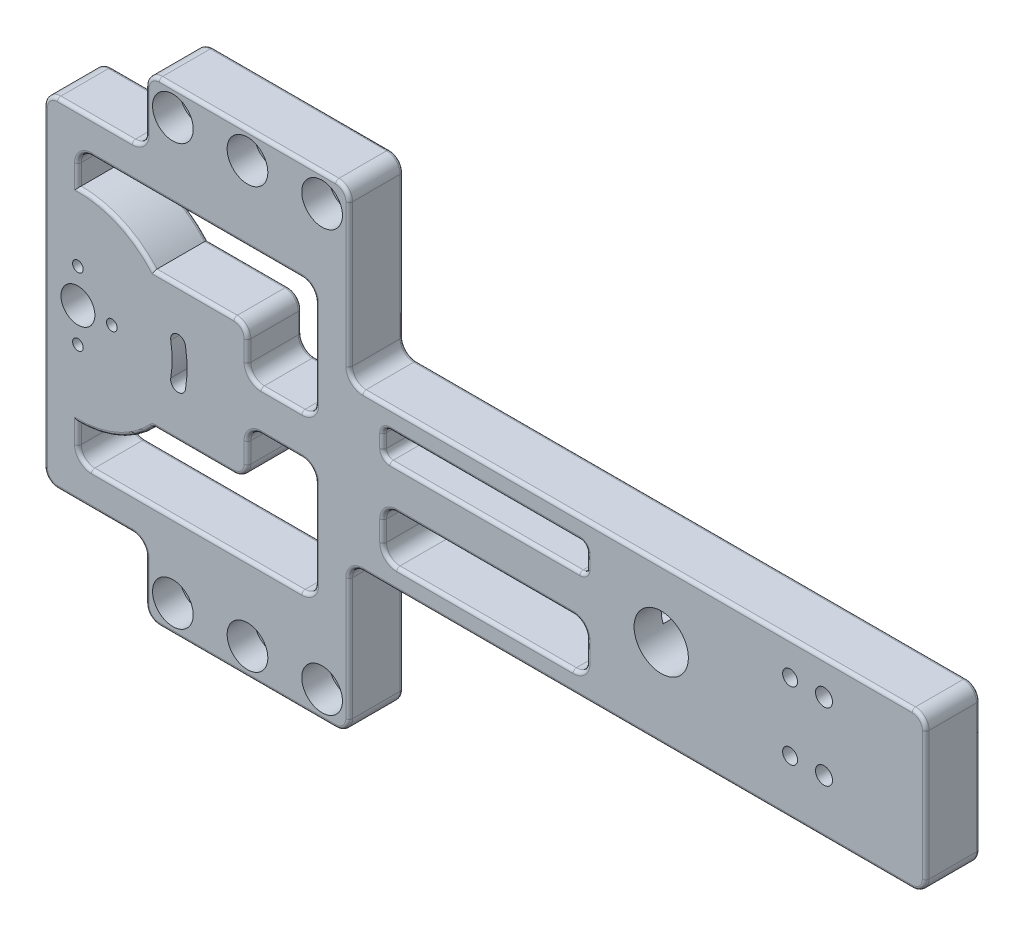
from build123d import *

# Parameters (mm, degrees)
BOSS_EXTRUDE1_DEPTH       = 8
SKETCH3_R                 = 3
CUT_EXTRUDE1_DEPTH        = 4
SKETCH3_3_R               = 1.6
CUT_EXTRUDE2_DEPTH        = 8
SKETCH4_R                 = 2.5
SKETCH4_R_2               = 0.7835
CUT_EXTRUDE3_DEPTH        = 4
SKETCH4_2_R               = 2.5
SKETCH4_2_R_2             = 0.7835
CUT_EXTRUDE4_DEPTH        = 8
FILLET1_R                 = 2
SKETCH6_R                 = 2
CUT_EXTRUDE6_DEPTH        = 4
SKETCH6_3_R               = 1.1
CUT_EXTRUDE7_DEPTH        = 8
SKETCH7_R                 = 4
CUT_EXTRUDE8_DEPTH        = 8
CUT_EXTRUDE9_DEPTH        = 4
SKETCH9_W                 = 30
SKETCH9_H                 = 4
SKETCH9_H_2               = 7
CUT_EXTRUDE10_DEPTH       = 8
FILLET2_R                 = 2
FILLET3_R                 = 1
FILLET4_R                 = 0.5
F_3_0MM_DOWEL_HOLE1_D     = 3
F_3_0MM_DOWEL_HOLE1_DEPTH = 6.098709071
F_3_0MM_DOWEL_HOLE1_TIP   = 0.901290929
THREAD1_PITCH             = 0.5
THREAD1_FROM              = 1
THREAD2_PITCH             = 0.5
THREAD2_FROM              = 1
F_2_5MM_DOWEL_HOLE1_D     = 2.5
F_2_5MM_DOWEL_HOLE1_DEPTH = 4
F_2_5MM_DOWEL_HOLE1_TIP   = 0.751075774
F_2_5MM_DOWEL_HOLE2_D     = 2.5
F_2_5MM_DOWEL_HOLE2_DEPTH = 4
F_2_5MM_DOWEL_HOLE2_TIP   = 0.751075774
CUT_EXTRUDE11_DEPTH       = 4
CUT_EXTRUDE12_DEPTH       = 8
F_2_5MM_DOWEL_HOLE3_D     = 2.5
F_2_5MM_DOWEL_HOLE3_DEPTH = 4
F_2_5MM_DOWEL_HOLE3_TIP   = 0.751075774


with BuildPart() as part:
    # Sketch1 → Boss-Extrude1 (new body)
    with BuildSketch(Plane.XY):
        Polygon((-65, 25), (-65, -25), (-50, -25), (-50, -35), (-20, -35), (-20, -13), (65, -13), (65, 10), (-20, 10), (-20, 35), (-50, 35), (-50, 25), align=None)
    extrude(amount=BOSS_EXTRUDE1_DEPTH)

    # Sketch3 → Cut-Extrude1 (cut)
    with BuildSketch(Plane.XY.offset(8)):
        with Locations((-46, -31)):
            Circle(SKETCH3_R)
        with Locations((-35, -31)):
            Circle(SKETCH3_R)
        with Locations((-24, -31)):
            Circle(SKETCH3_R)
    cut_extrude1 = extrude(amount=-CUT_EXTRUDE1_DEPTH, mode=Mode.SUBTRACT)

    # Sketch3<3> → Cut-Extrude2 (cut)
    with BuildSketch(Plane.XY.offset(8)):
        with Locations((-46, -31)):
            Circle(SKETCH3_3_R)
        with Locations((-35, -31)):
            Circle(SKETCH3_3_R)
        with Locations((-24, -31)):
            Circle(SKETCH3_3_R)
    cut_extrude2 = extrude(amount=-CUT_EXTRUDE2_DEPTH, mode=Mode.SUBTRACT)

    # Mirror1: Cut-Extrude1, Cut-Extrude2 across plane
    add(cut_extrude1.mirror(Plane.ZX), mode=Mode.SUBTRACT)
    add(cut_extrude2.mirror(Plane.ZX), mode=Mode.SUBTRACT)

    # Sketch4 → Cut-Extrude3 (cut)
    with BuildSketch(Plane(origin=(0, 0, 0), x_dir=(-1, 0, 0), z_dir=(0, 0, -1))):
        with BuildLine():
            Line((65, 6.244997998), (65, -6.244997998))
            ThreePointArc((65, -6.244997998), (52, 0), (65, 6.244997998))
        make_face()
        with Locations((60, 0)):
            Circle(SKETCH4_R, mode=Mode.SUBTRACT)
        with Locations((60, 5)):
            Circle(SKETCH4_R_2, mode=Mode.SUBTRACT)
        with Locations((55, 0)):
            Circle(SKETCH4_R_2, mode=Mode.SUBTRACT)
        with Locations((60, -5)):
            Circle(SKETCH4_R_2, mode=Mode.SUBTRACT)
    extrude(amount=-CUT_EXTRUDE3_DEPTH, mode=Mode.SUBTRACT)

    # Sketch4<2> → Cut-Extrude4 (cut)
    with BuildSketch(Plane(origin=(0, 0, 0), x_dir=(-1, 0, 0), z_dir=(0, 0, -1))):
        with Locations((60, 0)):
            Circle(SKETCH4_2_R)
        with Locations((60, 5)):
            Circle(SKETCH4_2_R_2)
        with Locations((55, 0)):
            Circle(SKETCH4_2_R_2)
        with Locations((60, -5)):
            Circle(SKETCH4_2_R_2)
    extrude(amount=-CUT_EXTRUDE4_DEPTH, mode=Mode.SUBTRACT)

    # Fillet1
    fillet1_edges = [part.edges().sort_by_distance(p)[0] for p in [
        (-50, 35, 4),
        (-20, 35, 4),
        (-20, 10, 4),
        (65, 10, 4),
        (65, -13, 4),
        (-20, -13, 4),
        (-20, -35, 4),
        (-50, -35, 4),
        (-50, -25, 4),
        (-65, -25, 4),
        (-65, 25, 4),
        (-50, 25, 4),
    ]]
    fillet(fillet1_edges, radius=FILLET1_R)

    # Sketch6 → Cut-Extrude6 (cut)
    with BuildSketch(Plane(origin=(0, 0, 0), x_dir=(-1, 0, 0), z_dir=(0, 0, -1))):
        with Locations((-45, 5)):
            Circle(SKETCH6_R)
        with Locations((-45, -5)):
            Circle(SKETCH6_R)
    extrude(amount=-CUT_EXTRUDE6_DEPTH, mode=Mode.SUBTRACT)

    # Sketch6<3> → Cut-Extrude7 (cut)
    with BuildSketch(Plane(origin=(0, 0, 0), x_dir=(-1, 0, 0), z_dir=(0, 0, -1))):
        with Locations((-45, 5)):
            Circle(SKETCH6_3_R)
        with Locations((-45, -5)):
            Circle(SKETCH6_3_R)
    extrude(amount=-CUT_EXTRUDE7_DEPTH, mode=Mode.SUBTRACT)

    # Sketch7 → Cut-Extrude8 (cut)
    with BuildSketch(Plane(origin=(0, 0, 0), x_dir=(-1, 0, 0), z_dir=(0, 0, -1))):
        with Locations((-26, 0)):
            Circle(SKETCH7_R)
    extrude(amount=-CUT_EXTRUDE8_DEPTH, mode=Mode.SUBTRACT)

    # Sketch7<3> → Cut-Extrude9 (cut)
    with BuildSketch(Plane(origin=(0, 0, 0), x_dir=(-1, 0, 0), z_dir=(0, 0, -1))):
        with BuildLine():
            Line((-31, 1.5), (-21, 1.5))
            ThreePointArc((-21, 1.5), (-19.5, 0), (-21, -1.5))
            Line((-21, -1.5), (-31, -1.5))
            ThreePointArc((-31, -1.5), (-32.5, 0), (-31, 1.5))
        make_face()
    extrude(amount=-CUT_EXTRUDE9_DEPTH, mode=Mode.SUBTRACT)

    # Sketch9 → Cut-Extrude10 (cut)
    with BuildSketch(Plane(origin=(0, 0, 0), x_dir=(-1, 0, 0), z_dir=(0, 0, -1))):
        with BuildLine():
            Line((35, 10), (35, 3))
            Line((35, 3), (25, 3))
            Line((25, 3), (25, 20))
            Line((25, 20), (60, 20))
            Line((60, 20), (60, 15))
            ThreePointArc((60, 15), (53.876275643, 13.693063938), (48.819660113, 10))
            Line((48.819660113, 10), (35, 10))
        make_face()
        with BuildLine():
            Line((35, -10), (48.819660113, -10))
            ThreePointArc((48.819660113, -10), (53.876275643, -13.693063938), (60, -15))
            Line((60, -15), (60, -20))
            Line((60, -20), (25, -20))
            Line((25, -20), (25, -3))
            Line((25, -3), (35, -3))
            Line((35, -3), (35, -10))
        make_face()
        with Locations((0, 5)):
            Rectangle(SKETCH9_W, SKETCH9_H)
        with Locations((0, -6.5)):
            Rectangle(SKETCH9_W, SKETCH9_H_2)
    extrude(amount=-CUT_EXTRUDE10_DEPTH, mode=Mode.SUBTRACT)

    # Fillet2
    fillet2_edges = [part.edges().sort_by_distance(p)[0] for p in [
        (-35, -3, 4),
        (-35, -10, 4),
        (-60, -20, 4),
        (-25, -20, 4),
        (-25, -3, 4),
        (15, -10, 4),
        (15, -3, 4),
        (-15, -3, 4),
        (-15, -10, 4),
        (-35, 10, 4),
        (-35, 3, 4),
        (-25, 3, 4),
        (-25, 20, 4),
        (-60, 20, 4),
    ]]
    fillet(fillet2_edges, radius=FILLET2_R)

    # Fillet3
    fillet3_edges = [part.edges().sort_by_distance(p)[0] for p in [
        (15, 3, 4),
        (15, 7, 4),
        (-15, 7, 4),
        (-15, 3, 4),
    ]]
    fillet(fillet3_edges, radius=FILLET3_R)

    # Fillet4
    fillet4_edges = [part.edges().sort_by_distance(p)[0] for p in [
        (-57.5, -25, 0),
        (-57.5, -25, 8),
        (-65, 14.622498999, 0),
        (-57.5, 25, 0),
        (-50, 30, 0),
        (-35, 35, 0),
        (-20, 22.5, 0),
        (22.5, 10, 0),
        (65, -1.5, 0),
        (22.5, -13, 0),
        (-20, -24, 0),
        (-35, -35, 0),
        (-50, -30, 0),
        (-64.414213562, 24.414213562, 0),
        (-49.414213562, 34.414213562, 0),
        (-20.585786438, 34.414213562, 0),
        (64.414213562, 9.414213562, 0),
        (64.414213562, -12.414213562, 0),
        (-20.585786438, -34.414213562, 0),
        (-49.414213562, -34.414213562, 0),
        (-64.414213562, -24.414213562, 0),
        (-65, 0, 8),
        (-50, 30, 8),
        (-57.5, 25, 8),
        (-50, -30, 8),
        (-35, -35, 8),
        (-20, -24, 8),
        (22.5, -13, 8),
        (65, -1.5, 8),
        (22.5, 10, 8),
        (-20, 22.5, 8),
        (-35, 35, 8),
        (-64.414213562, 24.414213562, 8),
        (-49.414213562, 34.414213562, 8),
        (-20.585786438, 34.414213562, 8),
        (64.414213562, 9.414213562, 8),
        (64.414213562, -12.414213562, 8),
        (-20.585786438, -34.414213562, 8),
        (-49.414213562, -34.414213562, 8),
        (-64.414213562, -24.414213562, 8),
        (-50.585786438, -25.585786438, 0),
        (-50.585786438, -25.585786438, 8),
        (-19.414213562, -13.585786438, 0),
        (-19.414213562, -13.585786438, 8),
        (-19.414213562, 10.585786438, 0),
        (-19.414213562, 10.585786438, 8),
        (-50.585786438, 25.585786438, 0),
        (-50.585786438, 25.585786438, 8),
        (-42.909830056, -10, 8),
        (-53.876275643, -13.693063938, 8),
        (-48.819660113, -10, 4),
        (-53.876275643, -13.693063938, 0),
        (-42.909830056, -10, 0),
        (-60, 16.5, 8),
        (-53.876275643, 13.693063938, 8),
        (-53.876275643, 13.693063938, 0),
        (-60, 16.5, 0),
        (-60, -16.5, 0),
        (-60, -16.5, 8),
        (-42.5, -20, 0),
        (-42.5, -20, 8),
        (-15, -6.5, 0),
        (-15, -6.5, 8),
        (0, -10, 0),
        (0, -10, 8),
        (15, -6.5, 0),
        (15, -6.5, 8),
        (0, -3, 0),
        (0, -3, 8),
        (-25, -11.5, 0),
        (-25, -11.5, 8),
        (-35, -6.5, 0),
        (-35, -6.5, 8),
        (-42.909830056, 10, 0),
        (-35, 6.5, 0),
        (-30, 3, 0),
        (-25, 11.5, 0),
        (-42.5, 20, 0),
        (-30, -3, 0),
        (-35.585786438, 9.414213562, 0),
        (-35.585786438, -9.414213562, 0),
        (-35, 6.5, 8),
        (-42.909830056, 10, 8),
        (-42.5, 20, 8),
        (-25, 11.5, 8),
        (-30, 3, 8),
        (-30, -3, 8),
        (-35.585786438, 9.414213562, 8),
        (-35.585786438, -9.414213562, 8),
        (-59.414213562, -19.414213562, 0),
        (-59.414213562, -19.414213562, 8),
        (-14.414213562, -9.414213562, 0),
        (-14.414213562, -9.414213562, 8),
        (14.414213562, -9.414213562, 0),
        (14.414213562, -9.414213562, 8),
        (-14.414213562, -3.585786438, 0),
        (-14.414213562, -3.585786438, 8),
        (14.414213562, -3.585786438, 0),
        (14.414213562, -3.585786438, 8),
        (-25.585786438, -19.414213562, 0),
        (-25.585786438, -19.414213562, 8),
        (-34.414213562, -3.585786438, 0),
        (-34.414213562, -3.585786438, 8),
        (-25.585786438, -3.585786438, 0),
        (-25.585786438, -3.585786438, 8),
        (-34.414213562, 3.585786438, 0),
        (-34.414213562, 3.585786438, 8),
        (-25.585786438, 3.585786438, 0),
        (-25.585786438, 3.585786438, 8),
        (-59.414213562, 19.414213562, 0),
        (-59.414213562, 19.414213562, 8),
        (-25.585786438, 19.414213562, 0),
        (-25.585786438, 19.414213562, 8),
        (-15, 5, 0),
        (-15, 5, 8),
        (0, 3, 0),
        (0, 3, 8),
        (0, 7, 0),
        (0, 7, 8),
        (15, 5, 0),
        (15, 5, 8),
        (-14.707106781, 3.292893219, 0),
        (-14.707106781, 3.292893219, 8),
        (-14.707106781, 6.707106781, 0),
        (-14.707106781, 6.707106781, 8),
        (14.707106781, 6.707106781, 0),
        (14.707106781, 6.707106781, 8),
        (14.707106781, 3.292893219, 0),
        (14.707106781, 3.292893219, 8),
        (-65, -14.622498999, 0),
        (-65, -6.244997998, 2),
        (-65, 6.244997998, 2),
        (-52, 0, 0),
    ]]
    fillet(fillet4_edges, radius=FILLET4_R)

    # Ø3.0mm Dowel Hole1
    with Locations(Plane(origin=(0, -13, 0), x_dir=(-1, 0, 0), z_dir=(0, -1, 0))):
        with Locations((-38, -4), (-53, -4)):
            Hole(F_3_0MM_DOWEL_HOLE1_D / 2, depth=F_3_0MM_DOWEL_HOLE1_DEPTH)
            with Locations((0, 0, -(F_3_0MM_DOWEL_HOLE1_DEPTH + F_3_0MM_DOWEL_HOLE1_TIP / 2))):  # 118° drill point
                Cone(0, F_3_0MM_DOWEL_HOLE1_D / 2, F_3_0MM_DOWEL_HOLE1_TIP, mode=Mode.SUBTRACT)

    # Thread1: arcs per turn and ends read off the stored shape
    # Thread1: the profile of Thread Profile1 profile screwed along a right-hand helix through 20 turns, 6 arcs to a turn; built about Z, then put on its axis
    thread1_z = Axis((0, 0, 0), (0, 0, 1))
    thread1_corners = [(1.5003, 0, -0.000173205), (1.5003, 0, 0.437673204), (1.229367063, 0, 0.281249999), (1.229367063, 0, 0.156249999)]
    with BuildLine(mode=Mode.PRIVATE) as thread1_profile:
        Line(thread1_corners[0], thread1_corners[1])
        Line(thread1_corners[1], thread1_corners[2])
        Line(thread1_corners[2], thread1_corners[3])
        Line(thread1_corners[3], thread1_corners[0])
    thread1_cap = Face(thread1_profile.wire())
    thread1_turn_angles = [0, 30, 60, 90, 120, 150, 180, 210, 240, 270, 300, 330, 360]
    thread1_turn_weights = [1, 0.8660254037844387, 1, 0.8660254037844387, 1, 0.8660254037844387, 1, 0.8660254037844387, 1, 0.8660254037844387, 1, 0.8660254037844387, 1]
    thread1_turn_rails = [Edge.make_bspline([Vector(p[0], p[1], 0).rotate(thread1_z, thread1_turn_angles[k]) / thread1_turn_weights[k] + Vector(0, 0, p[2] + THREAD1_PITCH * thread1_turn_angles[k] / 360) for k in range(13)], [0, 0, 0, 1, 1, 2, 2, 3, 3, 4, 4, 5, 5, 6, 6, 6], 2, thread1_turn_weights) for p in thread1_corners]
    thread1_turn_sides = [Face.make_surface_from_curves(thread1_turn_rails[p[0]], thread1_turn_rails[p[1]]) for p in [(0, 1), (1, 2), (2, 3), (3, 0)]]
    thread1 = Plane(origin=(53, -14, 4), x_dir=(1, 0, 0), z_dir=(0, 1, 0)) * split(Solid(Shell([*[p.moved(Location((0, 0, THREAD1_PITCH * i))) for i in range(20) for p in thread1_turn_sides], thread1_cap, thread1_cap.rotate(thread1_z, 7200).moved(Location((0, 0, THREAD1_PITCH * 7200 / 360)))])), bisect_by=Plane.XY.offset(THREAD1_FROM), keep=Keep.TOP, mode=Mode.PRIVATE)
    add(thread1)

    # Thread2: arcs per turn and ends read off the stored shape
    # Thread2: the profile of Thread Profile2 profile screwed along a right-hand helix through 20 turns, 6 arcs to a turn; built about Z, then put on its axis
    thread2_z = Axis((0, 0, 0), (0, 0, 1))
    thread2_corners = [(1.5003, 0, -0.000173205), (1.5003, 0, 0.437673204), (1.229367063, 0, 0.281249999), (1.229367063, 0, 0.156249999)]
    with BuildLine(mode=Mode.PRIVATE) as thread2_profile:
        Line(thread2_corners[0], thread2_corners[1])
        Line(thread2_corners[1], thread2_corners[2])
        Line(thread2_corners[2], thread2_corners[3])
        Line(thread2_corners[3], thread2_corners[0])
    thread2_cap = Face(thread2_profile.wire())
    thread2_turn_angles = [0, 30, 60, 90, 120, 150, 180, 210, 240, 270, 300, 330, 360]
    thread2_turn_weights = [1, 0.8660254037844387, 1, 0.8660254037844387, 1, 0.8660254037844387, 1, 0.8660254037844387, 1, 0.8660254037844387, 1, 0.8660254037844387, 1]
    thread2_turn_rails = [Edge.make_bspline([Vector(p[0], p[1], 0).rotate(thread2_z, thread2_turn_angles[k]) / thread2_turn_weights[k] + Vector(0, 0, p[2] + THREAD2_PITCH * thread2_turn_angles[k] / 360) for k in range(13)], [0, 0, 0, 1, 1, 2, 2, 3, 3, 4, 4, 5, 5, 6, 6, 6], 2, thread2_turn_weights) for p in thread2_corners]
    thread2_turn_sides = [Face.make_surface_from_curves(thread2_turn_rails[p[0]], thread2_turn_rails[p[1]]) for p in [(0, 1), (1, 2), (2, 3), (3, 0)]]
    thread2 = Plane(origin=(38, -14, 4), x_dir=(1, 0, 0), z_dir=(0, 1, 0)) * split(Solid(Shell([*[p.moved(Location((0, 0, THREAD2_PITCH * i))) for i in range(20) for p in thread2_turn_sides], thread2_cap, thread2_cap.rotate(thread2_z, 7200).moved(Location((0, 0, THREAD2_PITCH * 7200 / 360)))])), bisect_by=Plane.XY.offset(THREAD2_FROM), keep=Keep.TOP, mode=Mode.PRIVATE)
    add(thread2)

    # Ø2.5mm Dowel Hole1
    with Locations(Plane(origin=(0, -13, 0), x_dir=(-1, 0, 0), z_dir=(0, -1, 0))):
        with Locations((-48, -4), (-43, -4)):
            Hole(F_2_5MM_DOWEL_HOLE1_D / 2, depth=F_2_5MM_DOWEL_HOLE1_DEPTH)
            with Locations((0, 0, -(F_2_5MM_DOWEL_HOLE1_DEPTH + F_2_5MM_DOWEL_HOLE1_TIP / 2))):  # 118° drill point
                Cone(0, F_2_5MM_DOWEL_HOLE1_D / 2, F_2_5MM_DOWEL_HOLE1_TIP, mode=Mode.SUBTRACT)

    # Ø2.5mm Dowel Hole2
    with Locations(Plane(origin=(0, 0, 0), x_dir=(-1, 0, 0), z_dir=(0, 0, -1))):
        with Locations((29.5, 31), (40.5, 31), (29.5, -31), (40.5, -31)):
            Hole(F_2_5MM_DOWEL_HOLE2_D / 2, depth=F_2_5MM_DOWEL_HOLE2_DEPTH)
            with Locations((0, 0, -(F_2_5MM_DOWEL_HOLE2_DEPTH + F_2_5MM_DOWEL_HOLE2_TIP / 2))):  # 118° drill point
                Cone(0, F_2_5MM_DOWEL_HOLE2_D / 2, F_2_5MM_DOWEL_HOLE2_TIP, mode=Mode.SUBTRACT)

    # Sketch21 → Cut-Extrude11 (cut)
    with BuildSketch(Plane(origin=(0, 0, 0), x_dir=(-1, 0, 0), z_dir=(0, 0, -1))):
        with BuildLine():
            ThreePointArc((43.258268199, 2.95201902), (43, 0), (43.258268199, -2.95201902))
            ThreePointArc((43.258268199, -2.95201902), (45.57518006, -4.574338171), (47.197499211, -2.25742631))
            ThreePointArc((47.197499211, -2.25742631), (47, 0), (47.197499211, 2.25742631))
            ThreePointArc((47.197499211, 2.25742631), (45.57518006, 4.574338171), (43.258268199, 2.95201902))
        make_face()
    extrude(amount=-CUT_EXTRUDE11_DEPTH, mode=Mode.SUBTRACT)

    # Sketch21<3> → Cut-Extrude12 (cut)
    with BuildSketch(Plane(origin=(0, 0, 0), x_dir=(-1, 0, 0), z_dir=(0, 0, -1))):
        with BuildLine():
            ThreePointArc((44.144595177, 2.79573566), (43.9, 0), (44.144595177, -2.79573566))
            ThreePointArc((44.144595177, -2.79573566), (45.4188967, -3.688011193), (46.311172233, -2.41370967))
            ThreePointArc((46.311172233, -2.41370967), (46.1, 0), (46.311172233, 2.41370967))
            ThreePointArc((46.311172233, 2.41370967), (45.4188967, 3.688011193), (44.144595177, 2.79573566))
        make_face()
    extrude(amount=-CUT_EXTRUDE12_DEPTH, mode=Mode.SUBTRACT)

    # Ø2.5mm Dowel Hole3
    with Locations(Plane.XY.offset(8)):
        with Locations((50, 5), (50, -5)):
            Hole(F_2_5MM_DOWEL_HOLE3_D / 2, depth=F_2_5MM_DOWEL_HOLE3_DEPTH)
            with Locations((0, 0, -(F_2_5MM_DOWEL_HOLE3_DEPTH + F_2_5MM_DOWEL_HOLE3_TIP / 2))):  # 118° drill point
                Cone(0, F_2_5MM_DOWEL_HOLE3_D / 2, F_2_5MM_DOWEL_HOLE3_TIP, mode=Mode.SUBTRACT)


solid = part.part
